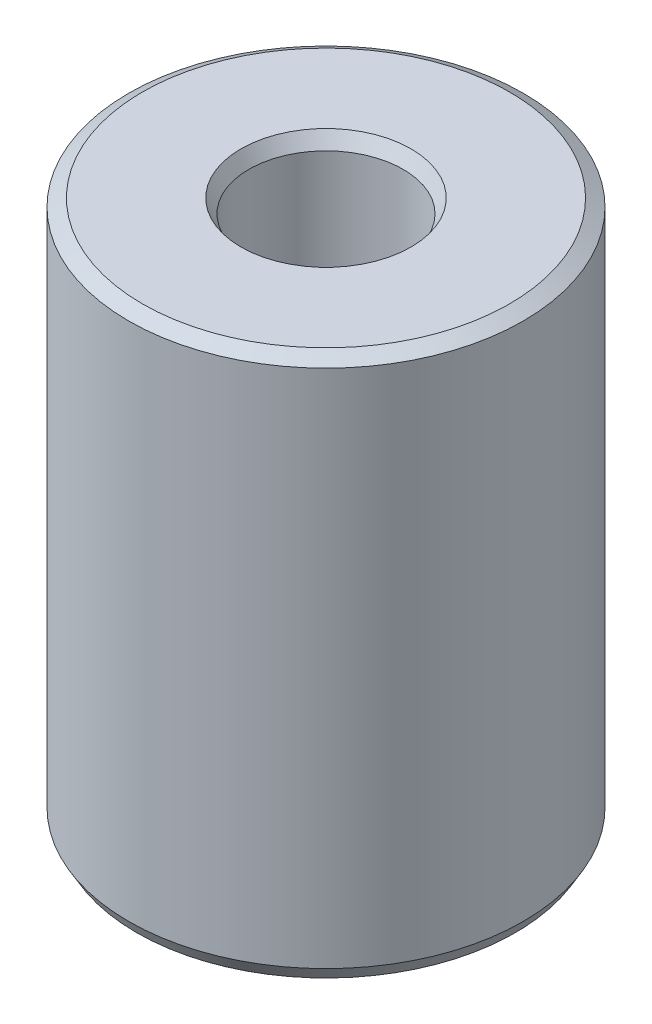
from build123d import *
from OCP.BRepFilletAPI import BRepFilletAPI_MakeChamfer

# Parameters (mm, degrees)
SKETCH1_R           = 15
BOSS_EXTRUDE1_DEPTH = 41.182224365
SKETCH2_R           = 5.863827244
CUT_EXTRUDE1_DEPTH  = 47.324675969
CHAMFER1_SIZE       = 0.60339805
CHAMFER1_SIZE2      = 1.04511608


with BuildPart() as part:
    # Sketch1 → Boss-Extrude1 (new body)
    with BuildSketch(Plane(origin=(0, 0, 0), x_dir=(1, 0, 0), z_dir=(0, 1, 0))):
        Circle(SKETCH1_R)
    extrude(amount=BOSS_EXTRUDE1_DEPTH)

    # Sketch2 → Cut-Extrude1 (cut, through all)
    with BuildSketch(Plane(origin=(0, 0, 0), x_dir=(1, 0, 0), z_dir=(0, 1, 0))):
        Circle(SKETCH2_R)
    extrude(amount=CUT_EXTRUDE1_DEPTH, mode=Mode.SUBTRACT)

    # Chamfer1: one chamfer whose edges measure the first distance from different faces: ONE call of the kernel's chamfer builder (chamfer() names one face for all edges)
    chamfer1_edges_1 = [part.edges().sort_by_distance(p)[0] for p in [
        (-5.863827244, 41.182224365, 0),
    ]]
    chamfer1_side_1 = [part.faces().sort_by_distance(p)[0] for p in [
        (-14.575735931, 41.182224365, 0),
    ]]
    chamfer1_edges_2 = [part.edges().sort_by_distance(p)[0] for p in [
        (-5.863827244, 0, 0),
    ]]
    chamfer1_side_2 = [part.faces().sort_by_distance(p)[0] for p in [
        (-5.863827244, 20.591112182, 0),
    ]]
    chamfer1_edges_3 = [part.edges().sort_by_distance(p)[0] for p in [
        (-15, 0, 0),
    ]]
    chamfer1_side_3 = [part.faces().sort_by_distance(p)[0] for p in [
        (-14.575735931, 0, 0),
    ]]
    chamfer1_edges_4 = [part.edges().sort_by_distance(p)[0] for p in [
        (-15, 41.182224365, 0),
    ]]
    chamfer1_side_4 = [part.faces().sort_by_distance(p)[0] for p in [
        (-15, 20.591112182, 0),
    ]]
    chamfer1 = BRepFilletAPI_MakeChamfer(part.part.solid().wrapped)
    for e in chamfer1_edges_1:
        chamfer1.Add(CHAMFER1_SIZE, CHAMFER1_SIZE2, e.wrapped, chamfer1_side_1[0].wrapped)  # the first distance lies on this face
    for e in chamfer1_edges_2:
        chamfer1.Add(CHAMFER1_SIZE, CHAMFER1_SIZE2, e.wrapped, chamfer1_side_2[0].wrapped)  # the first distance lies on this face
    for e in chamfer1_edges_3:
        chamfer1.Add(CHAMFER1_SIZE, CHAMFER1_SIZE2, e.wrapped, chamfer1_side_3[0].wrapped)  # the first distance lies on this face
    for e in chamfer1_edges_4:
        chamfer1.Add(CHAMFER1_SIZE, CHAMFER1_SIZE2, e.wrapped, chamfer1_side_4[0].wrapped)  # the first distance lies on this face
    add(Compound.cast(chamfer1.Shape()), mode=Mode.REPLACE)


solid = part.part
